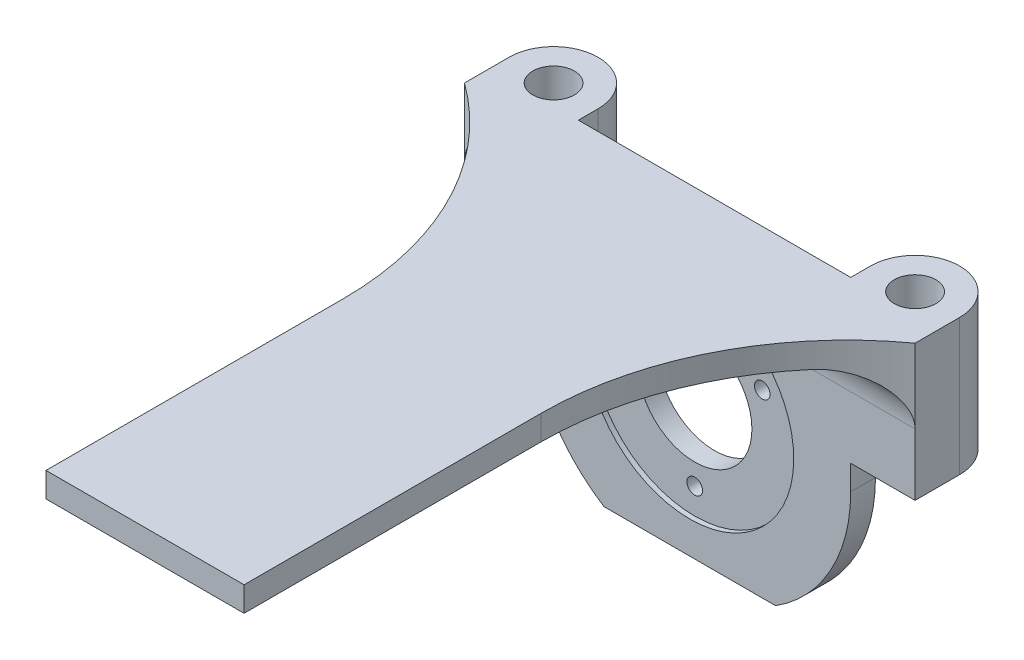
from build123d import *

# Parameters (mm, degrees)
SKETCH1_W                = 9
SKETCH1_H                = 55
SKETCH1_W_2              = 91
SKETCH1_H_2              = 5
BOSS_EXTRUDE3_DEPTH      = 5
SKETCH6_W                = 18
SKETCH6_H                = 60
BOSS_EXTRUDE4_DEPTH      = 18
SKETCH7_W                = 91
SKETCH7_H                = 5
BOSS_EXTRUDE5_DEPTH      = 100
SKETCH13_W               = 18
SKETCH13_H               = 5
CUT_EXTRUDE6_DEPTH       = 75
SKETCH16_R               = 4.2
CUT_EXTRUDE7_DEPTH       = 20
CUT_EXTRUDE8_DEPTH       = 75
CUT_EXTRUDE10_DEPTH      = 8
CUT_EXTRUDE11_DEPTH      = 22
CUT_EXTRUDE14_DEPTH      = 34
CUT_EXTRUDE14_DEPTH_BACK = 5
FILLET4_R                = 10
CUT_EXTRUDE15_DEPTH      = 24
CUT_EXTRUDE15_DEPTH_BACK = 1
SKETCH23_R               = 21
SKETCH26_R               = 1.575
CUT_EXTRUDE16_DEPTH      = 10
SKETCH27_W               = 40
SKETCH27_H               = 5
BOSS_EXTRUDE6_DEPTH      = 10


with BuildPart() as part:
    # Sketch1 → Boss-Extrude3 (new body)
    with BuildSketch(Plane.XY):
        with Locations((41, -0.737170899)):
            Rectangle(SKETCH1_W, SKETCH1_H)
        with Locations((32, -0.737170899)):
            Rectangle(SKETCH1_W, SKETCH1_H)
        with BuildLine():
            Line((27.5, 26.762829101), (0, 26.762829101))
            Line((0, 26.762829101), (0, 10.812829101))
            ThreePointArc((0, 10.812829101), (8.167083323, 7.429912424), (11.55, -0.737170899))
            ThreePointArc((11.55, -0.737170899), (8.167083323, -8.904254222), (0, -12.287170899))
            Line((0, -12.287170899), (0, -28.237170899))
            Line((0, -28.237170899), (27.5, -28.237170899))
            Line((27.5, -28.237170899), (27.5, 26.762829101))
        make_face()
        with BuildLine():
            Line((0, 10.812829101), (0, 26.762829101))
            Line((0, 26.762829101), (-27.5, 26.762829101))
            Line((-27.5, 26.762829101), (-27.5, -28.237170899))
            Line((-27.5, -28.237170899), (0, -28.237170899))
            Line((0, -28.237170899), (0, -12.287170899))
            ThreePointArc((0, -12.287170899), (-11.55, -0.737170899), (0, 10.812829101))
        make_face()
        with Locations((-32, -0.737170899)):
            Rectangle(SKETCH1_W, SKETCH1_H)
        with Locations((-41, -0.737170899)):
            Rectangle(SKETCH1_W, SKETCH1_H)
        with Locations((0, 29.262829101)):
            Rectangle(SKETCH1_W_2, SKETCH1_H_2)
    extrude(amount=BOSS_EXTRUDE3_DEPTH)

    # Sketch6 → Boss-Extrude4 (add)
    with BuildSketch(Plane(origin=(0, 0, 0), x_dir=(-1, 0, 0), z_dir=(0, 0, -1))):
        with Locations((-36.5, 1.762829101)):
            Rectangle(SKETCH6_W, SKETCH6_H)
        with Locations((36.5, 1.762829101)):
            Rectangle(SKETCH6_W, SKETCH6_H)
    extrude(amount=BOSS_EXTRUDE4_DEPTH)

    # Sketch7 → Boss-Extrude5 (add)
    with BuildSketch(Plane.XY.offset(5)):
        with Locations((0, 29.262829101)):
            Rectangle(SKETCH7_W, SKETCH7_H)
    extrude(amount=BOSS_EXTRUDE5_DEPTH)

    # Sketch13 → Cut-Extrude6 (cut)
    with BuildSketch(Plane(origin=(0, 31.762829101, 0), x_dir=(1, 0, 0), z_dir=(0, 1, 0))):
        with Locations((-36.5, 15.5)):
            Rectangle(SKETCH13_W, SKETCH13_H)
        with Locations((36.5, 15.5)):
            Rectangle(SKETCH13_W, SKETCH13_H)
    extrude(amount=-CUT_EXTRUDE6_DEPTH, mode=Mode.SUBTRACT)

    # Sketch16 → Cut-Extrude7 (cut)
    with BuildSketch(Plane(origin=(0, 31.762829101, 0), x_dir=(1, 0, 0), z_dir=(0, 1, 0))):
        with Locations(Location((-36.5, 4, 0), (0, 0, 180))):
            Circle(SKETCH16_R)
        with Locations(Location((36.5, 4, 0), (0, 0, 180))):
            Circle(SKETCH16_R)
    extrude(amount=-CUT_EXTRUDE7_DEPTH, mode=Mode.SUBTRACT)

    # Sketch17 → Cut-Extrude8 (cut)
    with BuildSketch(Plane(origin=(0, 31.762829101, 0), x_dir=(1, 0, 0), z_dir=(0, 1, 0))):
        with BuildLine():
            Line((-45.5, 13), (-45.5, 4))
            ThreePointArc((-45.5, 4), (-42.863961031, 10.363961031), (-36.5, 13))
            Line((-36.5, 13), (-45.5, 13))
        make_face()
        with BuildLine():
            ThreePointArc((-36.5, 13), (-30.136038969, 10.363961031), (-27.5, 4))
            Line((-27.5, 4), (-27.5, 13))
            Line((-27.5, 13), (-36.5, 13))
        make_face()
        with BuildLine():
            Line((27.5, 13), (27.5, 4))
            ThreePointArc((27.5, 4), (30.136038969, 10.363961031), (36.5, 13))
            Line((36.5, 13), (27.5, 13))
        make_face()
        with BuildLine():
            Line((45.5, 13), (36.5, 13))
            ThreePointArc((36.5, 13), (42.863961031, 10.363961031), (45.5, 4))
            Line((45.5, 4), (45.5, 13))
        make_face()
    extrude(amount=-CUT_EXTRUDE8_DEPTH, mode=Mode.SUBTRACT)

    # Sketch18 → Cut-Extrude10 (cut)
    with BuildSketch(Plane(origin=(0, 31.762829101, 0), x_dir=(1, 0, 0), z_dir=(0, 1, 0))):
        with BuildLine():
            ThreePointArc((-45.5, -105), (-26.743051045, -83.063543967), (-20, -55))
            Line((-20, -55), (-45.5, -55))
            Line((-45.5, -55), (-45.5, -105))
        make_face()
        with BuildLine():
            Line((-45.5, -55), (-20, -55))
            ThreePointArc((-20, -55), (-26.743051045, -26.936456033), (-45.5, -5))
            Line((-45.5, -5), (-45.5, -55))
        make_face()
        with BuildLine():
            ThreePointArc((-45.5, -105), (-26.743051045, -83.063543967), (-20, -55))
            Line((-20, -55), (-45.5, -55))
            Line((-45.5, -55), (-45.5, -105))
        make_face()
        with BuildLine():
            Line((-45.5, -55), (-20, -55))
            ThreePointArc((-20, -55), (-26.743051045, -26.936456033), (-45.5, -5))
            Line((-45.5, -5), (-45.5, -55))
        make_face()
        with BuildLine():
            Line((-20, -105), (-20, -55))
            ThreePointArc((-20, -55), (-26.743051045, -83.063543967), (-45.5, -105))
            Line((-45.5, -105), (-20, -105))
        make_face()
        with BuildLine():
            Line((20, -55), (20, -105))
            Line((20, -105), (45.5, -105))
            ThreePointArc((45.5, -105), (26.743051045, -83.063543967), (20, -55))
        make_face()
        with BuildLine():
            Line((45.5, -55), (45.5, -5))
            ThreePointArc((45.5, -5), (26.743051045, -26.936456033), (20, -55))
            Line((20, -55), (45.5, -55))
        make_face()
        with BuildLine():
            ThreePointArc((20, -55), (26.743051045, -83.063543967), (45.5, -105))
            Line((45.5, -105), (45.5, -55))
            Line((45.5, -55), (20, -55))
        make_face()
        with BuildLine():
            Line((45.5, -55), (45.5, -5))
            ThreePointArc((45.5, -5), (26.743051045, -26.936456033), (20, -55))
            Line((20, -55), (45.5, -55))
        make_face()
        with BuildLine():
            ThreePointArc((20, -55), (26.743051045, -83.063543967), (45.5, -105))
            Line((45.5, -105), (45.5, -55))
            Line((45.5, -55), (20, -55))
        make_face()
    extrude(amount=-CUT_EXTRUDE10_DEPTH, mode=Mode.SUBTRACT)

    # Sketch19 → Cut-Extrude11 (cut)
    with BuildSketch(Plane.XY.offset(5)):
        with BuildLine():
            Line((-32.5, -0.737170899), (-45.5, -0.737170899))
            Line((-45.5, -0.737170899), (-45.5, -28.237170899))
            Line((-45.5, -28.237170899), (-17.320508076, -28.237170899))
            ThreePointArc((-17.320508076, -28.237170899), (-28.453176558, -16.442798673), (-32.5, -0.737170899))
        make_face()
        with BuildLine():
            Line((45.5, -28.237170899), (17.320508076, -28.237170899))
            ThreePointArc((17.320508076, -28.237170899), (28.453176558, -16.442798673), (32.5, -0.737170899))
            Line((32.5, -0.737170899), (45.5, -0.737170899))
            Line((45.5, -0.737170899), (45.5, -28.237170899))
        make_face()
    extrude(amount=-CUT_EXTRUDE11_DEPTH, mode=Mode.SUBTRACT)

    # Sketch21 → Cut-Extrude14 (cut, two sides: drawn at the far end of the back side and taken through both)
    with BuildSketch(Plane.XZ.offset(0.737170899).offset(-CUT_EXTRUDE14_DEPTH_BACK)):
        with BuildLine():
            Line((27.5, 0), (32.5, 0))
            Line((32.5, 0), (32.5, 5))
            Line((32.5, 5), (45.5, 5))
            Line((45.5, 5), (45.5, -4))
            ThreePointArc((45.5, -4), (36.5, -13), (27.5, -4))
            Line((27.5, -4), (27.5, 0))
        make_face()
        with BuildLine():
            Line((-27.5, -4), (-27.5, 0))
            Line((-27.5, 0), (-32.5, 0))
            Line((-32.5, 0), (-32.5, 5))
            Line((-32.5, 5), (-45.5, 5))
            Line((-45.5, 5), (-45.5, -4))
            ThreePointArc((-45.5, -4), (-36.5, -13), (-27.5, -4))
        make_face()
    extrude(amount=CUT_EXTRUDE14_DEPTH + CUT_EXTRUDE14_DEPTH_BACK, mode=Mode.SUBTRACT)

    # Fillet4
    # the kernel refuses this fillet: 10 mm, written as the material it adds along each edge
    with BuildSketch(Plane(origin=(70.5, 26.762829101, 5), x_dir=(0, -1, 0), z_dir=(-1, 0, 0))) as fillet4_piece_1_section:
        with BuildLine():
            CenterArc((FILLET4_R, FILLET4_R), FILLET4_R, 180, 90)
            Line((0, FILLET4_R), (0, 0))
            Line((0, 0), (FILLET4_R, 0))
        make_face()
    fillet4_piece_1 = extrude(amount=141, mode=Mode.PRIVATE)
    fillet4_piece_1 = fillet4_piece_1 - Plane(origin=(-81.769607843, 24.471447362, 55), x_dir=(0.5871756209824568, 0, 0.8094595667010591), z_dir=(0, 1, 0)) * Cylinder(61.769607843, 322, mode=Mode.PRIVATE)
    fillet4_piece_1 = fillet4_piece_1 - Plane(origin=(81.769607843, 24.471447362, 55), x_dir=(-0.5871756209824566, 0, -0.8094595667010592), z_dir=(0, 1, 0)) * Cylinder(61.769607843, 322, mode=Mode.PRIVATE)
    add(fillet4_piece_1)

    # Sketch23 → Cut-Extrude15 (cut, two sides: drawn at the far end of the back side and taken through both)
    with BuildSketch(Plane.XY.offset(5).offset(-CUT_EXTRUDE15_DEPTH_BACK)):
        with Locations(Location((0, -0.737170899, 0), (0, 0, 123.557309762))):
            Circle(SKETCH23_R)
    extrude(amount=CUT_EXTRUDE15_DEPTH + CUT_EXTRUDE15_DEPTH_BACK, mode=Mode.SUBTRACT)

    # Sketch26 → Cut-Extrude16 (cut)
    with BuildSketch(Plane.XY.offset(4)):
        with Locations((0, -16.487170899)):
            Circle(SKETCH26_R)
        with Locations((-13.63990011, 7.137829101)):
            Circle(SKETCH26_R)
        with Locations((13.63990011, 7.137829101)):
            Circle(SKETCH26_R)
    extrude(amount=-CUT_EXTRUDE16_DEPTH, mode=Mode.SUBTRACT)

    # Sketch27 → Boss-Extrude6 (add)
    with BuildSketch(Plane.XY.offset(105)):
        with Locations((0, 29.262829101)):
            Rectangle(SKETCH27_W, SKETCH27_H)
    extrude(amount=BOSS_EXTRUDE6_DEPTH)


solid = part.part
